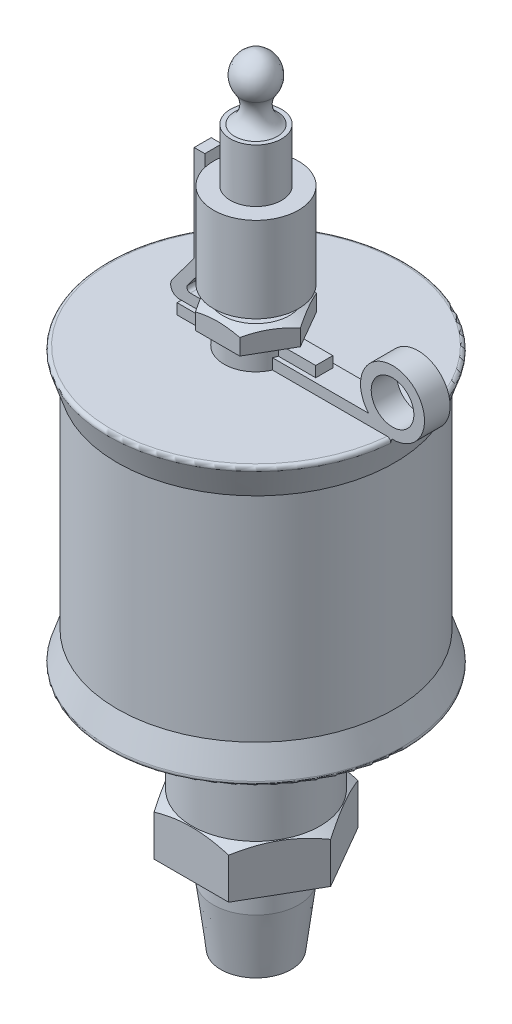
from build123d import *

# Parameters (mm, degrees)
SKETCH1_R           = 22.225
BOSS_EXTRUDE1_DEPTH = 20.6375
SKETCH2_W           = 9.896072905
SKETCH2_H           = 31.75
SKETCH4_W           = 10.31875
SKETCH4_H           = 6.35
SKETCH5_W           = 9.525
SKETCH5_H           = 9.525
BOSS_EXTRUDE2_DEPTH = 6.985
SKETCH12_W          = 6.35
SKETCH12_H          = 4.7625
SKETCH16_R          = 3.175
BOSS_EXTRUDE3_DEPTH = 1.905
BOSS_EXTRUDE4_DEPTH = 1.27
SKETCH18_W          = 4.7625
SKETCH18_H          = 3.175
BOSS_EXTRUDE5_DEPTH = 3.175
SKETCH21_R          = 3.96875
BOSS_EXTRUDE6_DEPTH = 1.5875
SKETCH25_W          = 6.3246
SKETCH25_H          = 12.7
SKETCH26_W          = 3.81
SKETCH26_H          = 7.9375
FILLET1_R           = 0.508


with BuildPart() as part:
    # Sketch1 → Boss-Extrude1 (new, symmetric)
    with BuildSketch(Plane(origin=(0, 0, 0), x_dir=(1, 0, 0), z_dir=(0, 1, 0))):
        Circle(SKETCH1_R)
    extrude(amount=BOSS_EXTRUDE1_DEPTH, both=True)

    # Sketch2 → Cut-Revolve1 (revolve, cut)
    with BuildSketch(Plane.XY):
        with Locations((25.585536453, 0)):
            Rectangle(SKETCH2_W, SKETCH2_H)
    revolve(axis=Axis((0, 21.577196935, 0), (0, -1, 0)), mode=Mode.SUBTRACT)

    # Sketch3 → Cut-Revolve2 (revolve, cut)
    with BuildSketch(Plane.XY):
        Polygon((22.225, 20.6375), (20.6375, 15.875), (22.225, 15.875), align=None)
        Polygon((20.6375, -15.875), (22.225, -15.875), (22.225, -20.6375), align=None)
    revolve(axis=Axis((0, 12.373614258, 0), (0, -1, 0)), mode=Mode.SUBTRACT)

    # Sketch4 → Revolve2 (revolve)
    with BuildSketch(Plane.XY):
        with Locations((-5.159375, -23.8125)):
            Rectangle(SKETCH4_W, SKETCH4_H)
    revolve(axis=Axis((0, 4.88407212, 0), (0, -1, 0)))

    # Sketch5 → Revolve3 (revolve)
    with BuildSketch(Plane.XY):
        with Locations((-4.7625, -31.75)):
            Rectangle(SKETCH5_W, SKETCH5_H)
    revolve(axis=Axis((0, -36.5125, 0), (0, 1, 0)))

    # Sketch6 → Boss-Extrude2 (add)
    with BuildSketch(Plane.XZ.offset(36.5125)):
        Polygon((11.1125, 0), (5.55625, 9.6237073), (-5.55625, 9.6237073), (-11.1125, 0), (-5.55625, -9.6237073), (5.55625, -9.6237073), align=None)
    extrude(amount=BOSS_EXTRUDE2_DEPTH)

    # Sketch11 → Cut-Revolve4 (revolve, cut)
    with BuildSketch(Plane.XY):
        Polygon((9.525, -36.5125), (11.1125, -37.429043552), (11.1125, -36.5125), align=None)
    revolve(axis=Axis((0, -29.103262268, 0), (0, -1, 0)), mode=Mode.SUBTRACT)

    # Sketch12 → Revolve4 (revolve)
    with BuildSketch(Plane.XY):
        with Locations((3.175, -45.87875)):
            Rectangle(SKETCH12_W, SKETCH12_H)
    revolve(axis=Axis((0, -48.26, 0), (0, 1, 0)))

    # Sketch13 → Revolve5 (revolve)
    with BuildSketch(Plane.XY):
        Polygon((0, -57.15), (5.23875, -57.15), (6.35, -48.26), (0, -48.26), align=None)
    revolve(axis=Axis((0, -48.26, 0), (0, -1, 0)))

    # Sketch16 → Boss-Extrude3 (add, symmetric)
    with BuildSketch(Plane.XY):
        with BuildLine():
            Line((-9.8425, 20.6375), (22.225, 20.6375))
            ThreePointArc((22.225, 20.6375), (24.169282483, 29.7475478), (18.675242086, 22.225))
            Line((18.675242086, 22.225), (-9.8425, 22.225))
            Line((-9.8425, 22.225), (-9.8425, 20.6375))
        make_face()
        with Locations((22.225, 25.4)):
            Circle(SKETCH16_R, mode=Mode.SUBTRACT)
    extrude(amount=BOSS_EXTRUDE3_DEPTH, both=True)

    # Sketch17 → Boss-Extrude4 (add, symmetric)
    with BuildSketch(Plane.XY):
        with BuildLine():
            Line((-7.9375, 28.575), (-11.176, 24.257))
            ThreePointArc((-11.176, 24.257), (-11.295922533, 22.927038734), (-10.16, 22.225))
            Line((-10.16, 22.225), (0, 22.225))
            Line((0, 22.225), (10.16, 22.225))
            Line((10.16, 22.225), (10.16, 23.8125))
            Line((10.16, 23.8125), (-8.509, 23.8125))
            ThreePointArc((-8.509, 23.8125), (-8.963369013, 24.093315493), (-8.9154, 24.6253))
            Line((-8.9154, 24.6253), (-6.35, 28.045833333))
            Line((-6.35, 28.045833333), (-6.35, 42.8625))
            Line((-6.35, 42.8625), (-7.9375, 42.8625))
            Line((-7.9375, 42.8625), (-7.9375, 28.575))
        make_face()
    extrude(amount=BOSS_EXTRUDE4_DEPTH, both=True)

    # Sketch18 → Revolve8 (revolve)
    with BuildSketch(Plane.XY):
        with Locations((2.38125, 22.225)):
            Rectangle(SKETCH18_W, SKETCH18_H)
    revolve(axis=Axis((0, 24.631710917, 0), (0, -1, 0)))

    # Sketch19 → Boss-Extrude5 (add)
    with BuildSketch(Plane(origin=(0, 23.8125, 0), x_dir=(1, 0, 0), z_dir=(0, 1, 0))):
        Polygon((3.299556788, 5.715), (-3.299556788, 5.715), (-6.599113577, 0), (-3.299556788, -5.715), (3.299556788, -5.715), (6.599113577, 0), align=None)
    extrude(amount=BOSS_EXTRUDE5_DEPTH)

    # Sketch20 → Cut-Revolve5 (revolve, cut)
    with BuildSketch(Plane.XY):
        Polygon((4.949335183, 26.9875), (6.599113577, 26.219283317), (6.599113577, 26.9875), align=None)
    revolve(axis=Axis((0, 32.000651273, 0), (0, -1, 0)), mode=Mode.SUBTRACT)

    # Sketch21 → Boss-Extrude6 (add)
    with BuildSketch(Plane(origin=(0, 26.9875, 0), x_dir=(1, 0, 0), z_dir=(0, 1, 0))):
        Circle(SKETCH21_R)
    extrude(amount=BOSS_EXTRUDE6_DEPTH)

    # Sketch25 → Revolve14 (revolve)
    with BuildSketch(Plane.XY):
        with Locations((-3.1623, 34.925)):
            Rectangle(SKETCH25_W, SKETCH25_H)
    revolve(axis=Axis((0, 45.49701587, 0), (0, -1, 0)))

    # Sketch26 → Revolve15 (revolve)
    with BuildSketch(Plane.XY):
        with Locations((1.905, 45.24375)):
            Rectangle(SKETCH26_W, SKETCH26_H)
    revolve(axis=Axis((0, 41.275, 0), (0, 1, 0)))

    # Sketch27 → Revolve16 (revolve)
    with BuildSketch(Plane.XY):
        with BuildLine():
            Line((3.175, 49.2125), (0, 49.2125))
            Line((0, 49.2125), (0, 58.7375))
            ThreePointArc((0, 58.7375), (2.657485002, 56.857335533), (2.305158809, 53.621116873))
            ThreePointArc((2.305158809, 53.621116873), (1.762305277, 51.223888925), (3.175, 49.2125))
        make_face()
    revolve(axis=Axis((0, 58.7375, 0), (0, -1, 0)))

    # Fillet1
    fillet1_edges = [part.edges().sort_by_distance(p)[0] for p in [
        (-22.225, -20.6375, 0),
        (-22.225, 20.6375, 0),
    ]]
    fillet(fillet1_edges, radius=FILLET1_R)


solid = part.part
